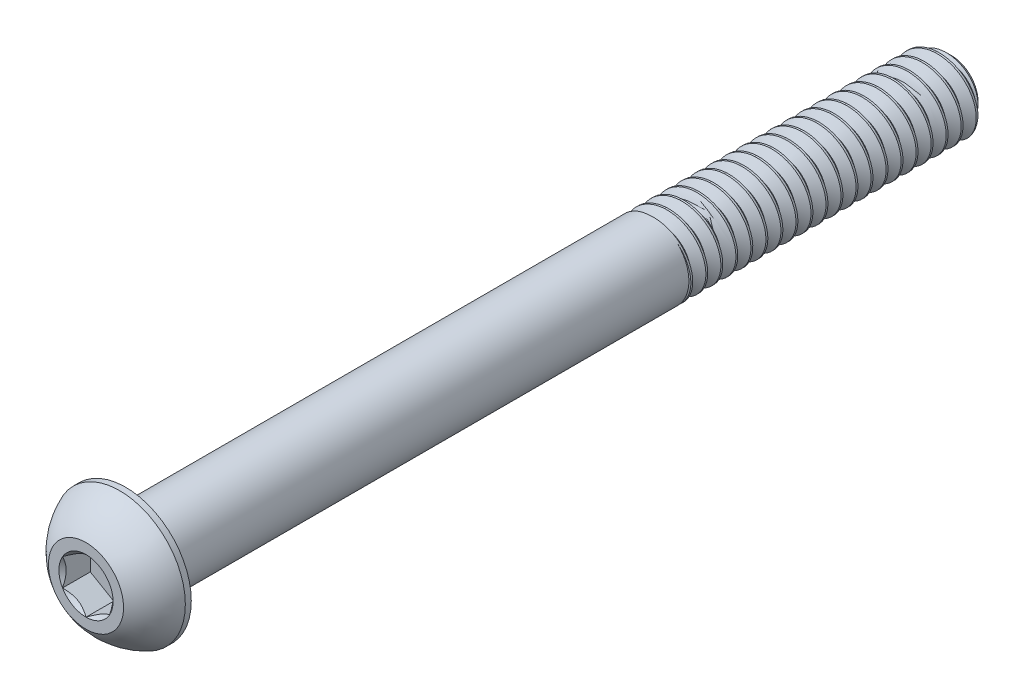
from build123d import *
from build123d.topology import SkipClean

# Parameters (mm, degrees)
SKETCH1_W           = 69.85
SKETCH1_H           = 3.175
CHAMFER1_SIZE       = 0.9525
CUT_SWEEP1_PITCH    = 1.27
CUT_EXTRUDE2_DEPTH  = 2.34696
BOSS_EXTRUDE2_START = -44.45
SKETCH9_R           = 3.175
BOSS_EXTRUDE2_DEPTH = 44.45


with BuildPart() as part:
    # Sketch1 → Revolve1 (revolve)
    with BuildSketch(Plane(origin=(0, 0, 0), x_dir=(0, 0, -1), z_dir=(1, 0, 0))):
        with Locations((38.2778, 1.5875)):
            Rectangle(SKETCH1_W, SKETCH1_H)
    revolve(axis=Axis((0, 0, -73.2028), (0, 0, 1)))

    # Chamfer1
    chamfer1_edges = [part.edges().sort_by_distance(p)[0] for p in [
        (0, -3.175, -73.2028),
    ]]
    chamfer(chamfer1_edges, length=CHAMFER1_SIZE)

    # Cut-Sweep1: the profile of Sketch2 profile screwed along a right-hand helix of 56 turns, 6 arcs to a turn; built about Z, then put on its axis
    cut_sweep1_z = Axis((0, 0, 0), (0, 0, 1))
    cut_sweep1_corners = [(3.1753, 0, 0.000173205), (3.1753, 0, -1.111423205), (2.350110803, 0, -0.635), (2.350110803, 0, -0.47625)]
    with BuildLine(mode=Mode.PRIVATE) as cut_sweep1_profile:
        Line(cut_sweep1_corners[0], cut_sweep1_corners[1])
        Line(cut_sweep1_corners[1], cut_sweep1_corners[2])
        Line(cut_sweep1_corners[2], cut_sweep1_corners[3])
        Line(cut_sweep1_corners[3], cut_sweep1_corners[0])
    cut_sweep1_cap = Face(cut_sweep1_profile.wire())
    cut_sweep1_turn_angles = [0, 30, 60, 90, 120, 150, 180, 210, 240, 270, 300, 330, 360, 390, 420, 450, 480, 510, 540, 570, 600, 630, 660, 690, 720]
    cut_sweep1_turn_weights = [1, 0.8660254037844387, 1, 0.8660254037844387, 1, 0.8660254037844387, 1, 0.8660254037844387, 1, 0.8660254037844387, 1, 0.8660254037844387, 1, 0.8660254037844387, 1, 0.8660254037844387, 1, 0.8660254037844387, 1, 0.8660254037844387, 1, 0.8660254037844387, 1, 0.8660254037844387, 1]
    cut_sweep1_turn_rails = [Edge.make_bspline([Vector(p[0], p[1], 0).rotate(cut_sweep1_z, cut_sweep1_turn_angles[k]) / cut_sweep1_turn_weights[k] + Vector(0, 0, p[2] + CUT_SWEEP1_PITCH * cut_sweep1_turn_angles[k] / 360) for k in range(25)], [0, 0, 0, 1, 1, 2, 2, 3, 3, 4, 4, 5, 5, 6, 6, 7, 7, 8, 8, 9, 9, 10, 10, 11, 11, 12, 12, 12], 2, cut_sweep1_turn_weights) for p in cut_sweep1_corners]
    cut_sweep1_turn_sides = [Face.make_surface_from_curves(cut_sweep1_turn_rails[p[0]], cut_sweep1_turn_rails[p[1]]) for p in [(0, 1), (1, 2), (2, 3), (3, 0)]]
    cut_sweep1 = Plane(origin=(0, 0, -73.2028), x_dir=(0, 1, 0), z_dir=(0, 0, 1)) * Solid(Shell([*[p.moved(Location((0, 0, 2 * CUT_SWEEP1_PITCH * i))) for i in range(28) for p in cut_sweep1_turn_sides], cut_sweep1_cap, cut_sweep1_cap.rotate(cut_sweep1_z, 20160).moved(Location((0, 0, CUT_SWEEP1_PITCH * 20160 / 360)))]))
    add(cut_sweep1, mode=Mode.SUBTRACT)

    # Sketch7 → Revolve2 (revolve)
    with BuildSketch(Plane(origin=(0, 0, 0), x_dir=(0, 0, -1), z_dir=(1, 0, 0))):
        with BuildLine():
            Line((2.84988, 5.5499), (3.3528, 5.5499))
            Line((3.3528, 5.5499), (3.3528, 0))
            Line((3.3528, 0), (0, 0))
            Line((0, 0), (0, 3.175))
            ThreePointArc((0, 3.175), (1.235921075, 4.58927271), (2.84988, 5.5499))
        make_face()
    revolve(axis=Axis((0, 0, 0), (0, 0, -1)))

    # Sketch5 → Cut-Extrude2 (cut)
    with BuildSketch(Plane.XY):
        Polygon((1.984375, -1.14567944), (1.984375, 1.14567944), (0, 2.291358881), (-1.984375, 1.14567944), (-1.984375, -1.14567944), (0, -2.291358881), align=None)
    extrude(amount=-CUT_EXTRUDE2_DEPTH, mode=Mode.SUBTRACT)

    # Cut-Extrude3 cone 1 section (through the dimple's axis) → Cut-Extrude3 (revolve, cut)
    with BuildSketch(Plane(origin=(0, 0, 0), x_dir=(0, -1, 0), z_dir=(1, 0, 0))):
        Polygon((0, 0), (2.291358881, 0), (0, 2.291358881), align=None)
    revolve(axis=Axis((0, 0, 0), (0, 0, -1)), mode=Mode.SUBTRACT)

    # Sketch9 → Boss-Extrude2 (add)
    with SkipClean():  # the faces are left unmerged after this step: merging them gives an invalid solid
        with BuildSketch(Plane.XY.offset(-3.3528).offset(BOSS_EXTRUDE2_START)):
            with Locations(Location((0, 0, 0), (0, 0, 90))):
                Circle(SKETCH9_R)
        extrude(amount=BOSS_EXTRUDE2_DEPTH)


solid = part.part
